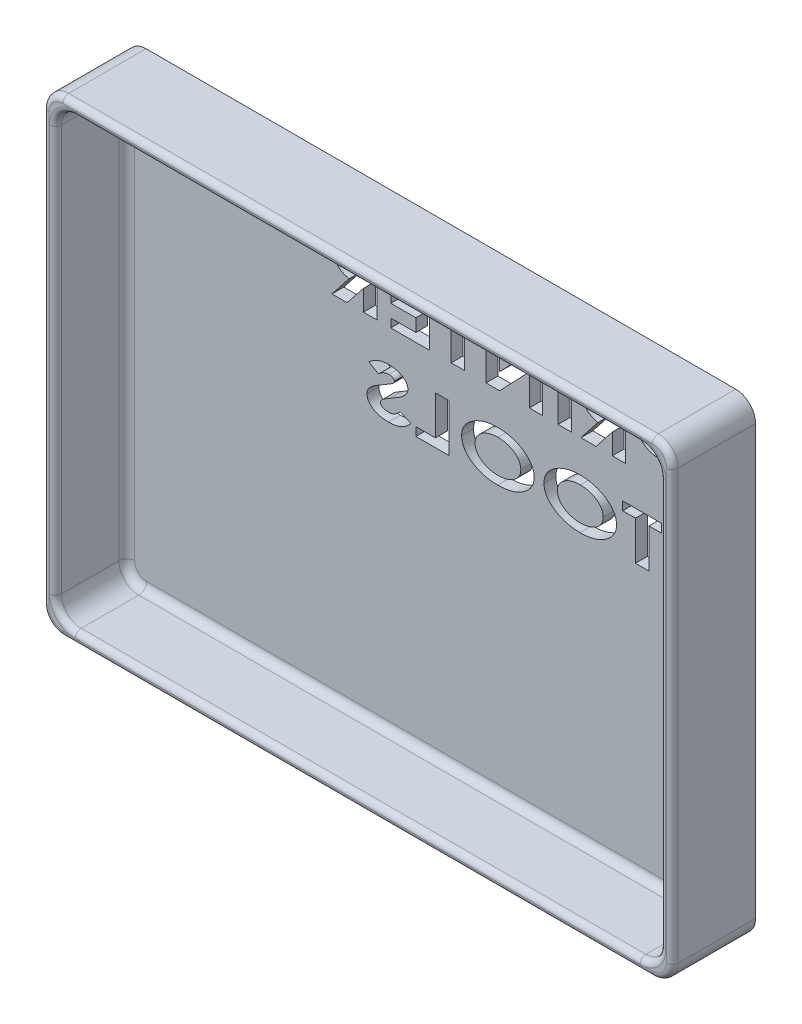
from build123d import *

# Parameters (mm, degrees)
SKETCH1_W              = 158.683863027
SKETCH1_H              = 118.102023858
BOSS_EXTRUDE1_DEPTH    = 3
BOSS_EXTRUDE2_DEPTH    = 21
CUT_EXTRUDE1_START     = -3
CUT_EXTRUDE1_OUTLINE_W = 3.384615385
CUT_EXTRUDE1_OUTLINE_H = 12
CUT_EXTRUDE1_DEPTH     = 3
FILLET1_R              = 5
FILLET2_R              = 2
FILLET3_R              = 1.5


# Read off the part's stored shape, not the designer's step: Cut-Extrude1
with BuildPart() as part:
    # Sketch1 → Boss-Extrude1 (new body)
    with BuildSketch(Plane.XY):
        with Locations((1.187532467, -8.698701299)):
            Rectangle(SKETCH1_W, SKETCH1_H)
    extrude(amount=BOSS_EXTRUDE1_DEPTH)

    # Sketch1<3> → Boss-Extrude2 (add)
    with BuildSketch(Plane.XY):
        Polygon((-75.012467532, 47.501298701), (77.387532468, 47.501298701), (80.529463981, 50.35231063), (-78.154399046, 50.35231063), align=None)
        Polygon((77.387532468, 47.501298701), (77.387532468, -64.898701299), (80.529463981, -67.749713228), (80.529463981, 50.35231063), align=None)
        Polygon((77.387532468, -64.898701299), (80.529463981, -67.749713228), (-78.154399046, -67.749713228), (-78.154399046, 50.35231063), (-75.012467532, 47.501298701), (-75.012467532, -64.898701299), align=None)
    extrude(amount=BOSS_EXTRUDE2_DEPTH)

    # Cut-Extrude1 outline → Cut-Extrude1 (cut)
    # profile 1 of 12: a face of its own
    with BuildSketch(Plane(origin=(0, 0, 0), x_dir=(-1, 0, 0), z_dir=(0, 0, -1)).offset(CUT_EXTRUDE1_START)):
        with BuildLine():
            add(Edge.make_bspline(
                [(-61.338670517, 35.229174761), (-61.103084496, 35.228486284), (-60.64947422, 35.227160653), (-59.994655416, 35.210567101), (-59.391222931, 35.181379158), (-58.837960645, 35.144653532), (-58.335434607, 35.09378821), (-57.883619534, 35.035607474), (-57.483049594, 34.964416288), (-57.128326221, 34.879596374), (-56.808221375, 34.780577314), (-56.508096786, 34.674459724), (-56.228373705, 34.547079836), (-55.961258374, 34.415306874), (-55.716372132, 34.260789572), (-55.484356361, 34.099358589), (-55.272057453, 33.919854103), (-55.077365877, 33.727951904), (-54.902360005, 33.524882351), (-54.749144147, 33.311141098), (-54.618321929, 33.088275523), (-54.515304306, 32.852735764), (-54.433387467, 32.608988354), (-54.371707954, 32.355185588), (-54.339117298, 32.090609267), (-54.334028587, 31.911144111), (-54.331458979, 31.820520915)],
                knots=[0, 0, 0, 0, 0.081113678, 0.156180735, 0.22550834, 0.289116505, 0.347067955, 0.39939195, 0.445931657, 0.487084678, 0.524873618, 0.561267118, 0.596590797, 0.630645116, 0.663720921, 0.696177651, 0.727899058, 0.759308193, 0.790220241, 0.820078933, 0.849748386, 0.879021393, 0.908422828, 0.938201113, 0.968793872, 1, 1, 1, 1], degree=3))
            Line((-61.338670517, 35.229174761), (-64.946843594, 35.229174761))
            Line((-64.946843594, 35.229174761), (-64.946843594, 23.229174761))
            Line((-64.946843594, 23.229174761), (-61.562228209, 23.229174761))
            Line((-61.562228209, 23.229174761), (-61.562228209, 28.459943992))
            add(Edge.make_bspline(
                [(-57.970882056, 28.6426363), (-58.061299443, 28.627306207), (-58.258263836, 28.593911277), (-58.581085365, 28.560647266), (-58.953733939, 28.529455427), (-59.377677813, 28.502857971), (-59.852197033, 28.484999704), (-60.377866321, 28.47069173), (-60.95321476, 28.460520361), (-61.353890153, 28.460141163), (-61.562228209, 28.459943992)],
                knots=[0, 0, 0, 0, 0.076414094, 0.166459751, 0.270333959, 0.388098118, 0.520432678, 0.666070712, 0.826367729, 1, 1, 1, 1], degree=3))
            add(Edge.make_bspline(
                [(-54.331458979, 31.820520915), (-54.333972207, 31.720182534), (-54.338925379, 31.52243153), (-54.38582871, 31.232816525), (-54.462798333, 30.955981783), (-54.572505439, 30.692946031), (-54.709270772, 30.441016417), (-54.880156046, 30.204167383), (-55.080033189, 29.979355114), (-55.312835333, 29.772354632), (-55.566755512, 29.574061602), (-55.846249308, 29.395238915), (-56.146563014, 29.230471813), (-56.469075882, 29.082224022), (-56.81352202, 28.94775607), (-57.179244199, 28.827540012), (-57.56682389, 28.723593828), (-57.834329238, 28.669996169), (-57.970882056, 28.6426363)],
                knots=[0, 0, 0, 0, 0.057106212, 0.112547268, 0.166578841, 0.220390294, 0.27450851, 0.329464812, 0.386346329, 0.445466309, 0.506620577, 0.569654476, 0.634188479, 0.701563956, 0.771643545, 0.844661138, 0.920704542, 1, 1, 1, 1], degree=3))
        make_face()
        with BuildLine():
            add(Edge.make_bspline(
                [(-60.502132056, 30.613790146), (-60.401970667, 30.614444638), (-60.209649816, 30.615701335), (-59.933153066, 30.619842513), (-59.679854898, 30.629109753), (-59.45072655, 30.644018865), (-59.244548194, 30.659741272), (-59.063483474, 30.681670777), (-58.90518777, 30.704747877), (-58.729827182, 30.742120432), (-58.537399643, 30.802224006), (-58.330649897, 30.893888871), (-58.148772663, 31.003496777), (-57.994831726, 31.134689447), (-57.87101537, 31.283964705), (-57.779984271, 31.449937309), (-57.724607429, 31.631954353), (-57.718955852, 31.758436922), (-57.716074363, 31.822924761)],
                knots=[0, 0, 0, 0, 0.088908409, 0.170713896, 0.24544874, 0.313861441, 0.374521884, 0.428954165, 0.47572897, 0.516462857, 0.58799864, 0.654220813, 0.716798205, 0.775814359, 0.832913607, 0.887974223, 0.942883036, 1, 1, 1, 1], degree=3))
            Line((-60.502132056, 30.613790146), (-61.562228209, 30.613790146))
            Line((-61.562228209, 30.613790146), (-61.562228209, 33.075328608))
            Line((-61.562228209, 33.075328608), (-60.622324363, 33.075328608))
            add(Edge.make_bspline(
                [(-58.502132056, 32.837347838), (-58.554722277, 32.856704993), (-58.66790156, 32.898363475), (-58.858112074, 32.945026453), (-59.077378685, 32.984615405), (-59.327631043, 33.018401549), (-59.607558177, 33.043696015), (-59.918540471, 33.063574813), (-60.260108348, 33.071423187), (-60.498125347, 33.073989491), (-60.622324363, 33.075328608)],
                knots=[0, 0, 0, 0, 0.078376775, 0.168674459, 0.273588489, 0.390153308, 0.52193405, 0.666870742, 0.82617071, 1, 1, 1, 1], degree=3))
            add(Edge.make_bspline(
                [(-57.716074363, 31.822924761), (-57.718305564, 31.879194098), (-57.722657642, 31.988950489), (-57.75903025, 32.148108707), (-57.823559844, 32.294397733), (-57.909931075, 32.430165526), (-58.023199236, 32.551860064), (-58.160405067, 32.659842848), (-58.319456331, 32.760630236), (-58.439542306, 32.811062269), (-58.502132056, 32.837347838)],
                knots=[0, 0, 0, 0, 0.122923274, 0.23976851, 0.354306578, 0.470915258, 0.5899199, 0.71575388, 0.851848698, 1, 1, 1, 1], degree=3))
        make_face(mode=Mode.SUBTRACT)
    # profile 2 of 12: a face of its own
    with BuildSketch(Plane(origin=(0, 0, 0), x_dir=(-1, 0, 0), z_dir=(0, 0, -1)).offset(CUT_EXTRUDE1_START)):
        with BuildLine():
            add(Edge.make_bspline(
                [(8.928156406, 14.998405531), (9.143935073, 14.993269276), (9.571262309, 14.983097458), (10.203240494, 14.903545004), (10.819487901, 14.776764515), (11.321421027, 14.625789296), (11.719905179, 14.475220182), (12.024975031, 14.340670511), (12.334957082, 14.182685631), (12.653883651, 14.007845487), (12.976494419, 13.807479137), (13.306720783, 13.588875709), (13.641423397, 13.347667335), (13.862990008, 13.175396135), (13.976233329, 13.087347838)],
                knots=[0, 0, 0, 0, 0.117383059, 0.232464956, 0.346021993, 0.459404796, 0.517222591, 0.577739236, 0.640720293, 0.706487541, 0.775582806, 0.847291856, 0.921950437, 1, 1, 1, 1], degree=3))
            add(Edge.make_bspline(
                [(4.130079483, 11.9551363), (4.134108574, 12.058059425), (4.14209179, 12.261990674), (4.21030802, 12.561624882), (4.318908258, 12.849891287), (4.472468336, 13.126455666), (4.6705494, 13.389153757), (4.907514773, 13.643926103), (5.191387486, 13.883489423), (5.513842289, 14.109147513), (5.867384861, 14.316820253), (6.244993093, 14.499860511), (6.643498802, 14.653120834), (7.060816058, 14.781645496), (7.498967826, 14.879396639), (7.957562991, 14.948913702), (8.436223183, 14.989804995), (8.762212176, 14.995504305), (8.928156406, 14.998405531)],
                knots=[0, 0, 0, 0, 0.049357486, 0.097796619, 0.146734136, 0.196835447, 0.2490722, 0.304319524, 0.363522771, 0.427020094, 0.493056637, 0.560151219, 0.628226583, 0.697824819, 0.769586562, 0.843517546, 0.920342831, 1, 1, 1, 1], degree=3))
            add(Edge.make_bspline(
                [(8.666137175, 7.743597838), (8.437357084, 7.872681148), (7.999601495, 8.119673532), (7.378187996, 8.48539006), (6.819971734, 8.828575498), (6.325061174, 9.149493108), (5.893772173, 9.44769365), (5.524100847, 9.720703134), (5.218240991, 9.971585756), (4.969328015, 10.204222167), (4.771940558, 10.430383163), (4.597538339, 10.645204496), (4.45733254, 10.865642743), (4.336485464, 11.082511874), (4.245224797, 11.301277055), (4.180301909, 11.519688645), (4.135879567, 11.736989833), (4.132002513, 11.882809358), (4.130079483, 11.9551363)],
                knots=[0, 0, 0, 0, 0.122390303, 0.234185759, 0.335932589, 0.427680274, 0.508976885, 0.580210654, 0.641731503, 0.69322682, 0.738710084, 0.781507703, 0.821997537, 0.860255403, 0.897072557, 0.932152684, 0.966347519, 1, 1, 1, 1], degree=3))
            add(Edge.make_bspline(
                [(11.053156406, 5.6738863), (11.048152971, 5.742856905), (11.037783284, 5.885799437), (10.944043941, 6.093598051), (10.80419999, 6.301101832), (10.641618463, 6.468196998), (10.475539673, 6.607260051), (10.315782409, 6.730875805), (10.121708452, 6.866017492), (9.89454024, 7.015376707), (9.634678609, 7.178551446), (9.342259807, 7.35579432), (9.016149492, 7.546613633), (8.786530651, 7.675841328), (8.666137175, 7.743597838)],
                knots=[0, 0, 0, 0, 0.062969602, 0.13050537, 0.205695662, 0.291958675, 0.343039607, 0.404319287, 0.477087212, 0.55981761, 0.65358231, 0.758414432, 0.873332144, 1, 1, 1, 1], degree=3))
            add(Edge.make_bspline(
                [(9.038733329, 4.536867069), (9.175245961, 4.540680021), (9.439503872, 4.548061043), (9.817408385, 4.614080602), (10.1636765, 4.718284258), (10.420969785, 4.847490441), (10.606366755, 4.962467115), (10.724598576, 5.053797891), (10.824605556, 5.149358629), (10.90975528, 5.245707082), (10.972535677, 5.349024204), (11.020269838, 5.453372049), (11.046891018, 5.56280504), (11.051070223, 5.636899627), (11.053156406, 5.6738863)],
                knots=[0, 0, 0, 0, 0.162326861, 0.314228481, 0.455070169, 0.591104312, 0.655387981, 0.714514441, 0.768471015, 0.819873192, 0.866974029, 0.911800014, 0.955972167, 1, 1, 1, 1], degree=3))
            add(Edge.make_bspline(
                [(6.146906406, 6.075328608), (6.251247605, 5.953065477), (6.454265689, 5.71517645), (6.788214963, 5.401654918), (7.132840041, 5.13464747), (7.490538191, 4.916221753), (7.860142174, 4.746622068), (8.241718373, 4.625047338), (8.635975012, 4.550447086), (8.903796478, 4.541416807), (9.038733329, 4.536867069)],
                knots=[0, 0, 0, 0, 0.142103254, 0.276492224, 0.404377118, 0.527160615, 0.646425526, 0.763221357, 0.880703496, 1, 1, 1, 1], degree=3))
            Line((6.146906406, 6.075328608), (3.360848714, 4.938309377))
            add(Edge.make_bspline(
                [(9.031521791, 2.383020915), (8.876826887, 2.384791195), (8.572769905, 2.388270727), (8.12439393, 2.417978497), (7.691929895, 2.465254669), (7.273994809, 2.533036223), (6.870966835, 2.618682452), (6.482597303, 2.724870795), (6.109896453, 2.849319215), (5.751714832, 2.994391188), (5.407665994, 3.159920072), (5.077137057, 3.348467086), (4.759301953, 3.558180493), (4.452470525, 3.789192406), (4.160556708, 4.045098472), (3.877300427, 4.318901547), (3.610258751, 4.617982348), (3.444584312, 4.830764485), (3.360848714, 4.938309377)],
                knots=[0, 0, 0, 0, 0.0716858, 0.140900364, 0.208154577, 0.273234001, 0.33703695, 0.39901669, 0.459728605, 0.519032979, 0.577994543, 0.63653714, 0.695244395, 0.754363619, 0.814379911, 0.875041835, 0.936843325, 1, 1, 1, 1], degree=3))
            add(Edge.make_bspline(
                [(14.437771791, 5.7988863), (14.433118405, 5.677553623), (14.423948153, 5.438447852), (14.351916443, 5.087820234), (14.233841558, 4.754512846), (14.067638614, 4.437403462), (13.853016573, 4.138561223), (13.595013927, 3.852683422), (13.285198826, 3.589154983), (12.93629344, 3.339761713), (12.548088573, 3.116693844), (12.130190323, 2.91745346), (11.682351739, 2.752912016), (11.206358564, 2.618493342), (10.702675126, 2.513228293), (10.171257735, 2.436832795), (9.610886773, 2.390215963), (9.2279284, 2.38546006), (9.031521791, 2.383020915)],
                knots=[0, 0, 0, 0, 0.051356754, 0.101206836, 0.150904202, 0.200693022, 0.252294751, 0.306352288, 0.363371091, 0.424204089, 0.487766467, 0.552738298, 0.620064069, 0.689568172, 0.762050763, 0.837833145, 0.916830015, 1, 1, 1, 1], degree=3))
            add(Edge.make_bspline(
                [(12.574791021, 8.551290146), (12.656925326, 8.493351146), (12.816593742, 8.380718203), (13.042620586, 8.207408298), (13.250611128, 8.036202994), (13.439417735, 7.867265277), (13.60930446, 7.698746975), (13.764307016, 7.535523738), (13.894974969, 7.368163666), (14.050001034, 7.155955675), (14.202748703, 6.879878319), (14.341833441, 6.534546724), (14.422462202, 6.171173493), (14.432648783, 5.923463784), (14.437771791, 5.7988863)],
                knots=[0, 0, 0, 0, 0.086899156, 0.168931249, 0.246193543, 0.319780837, 0.387876716, 0.453077543, 0.514209315, 0.571309905, 0.680188041, 0.785939836, 0.892345452, 1, 1, 1, 1], degree=3))
            add(Edge.make_bspline(
                [(10.259887175, 9.935905531), (10.411356491, 9.848613006), (10.698452351, 9.683158225), (11.105869295, 9.447400574), (11.465339206, 9.236137192), (11.779129647, 9.051044839), (12.044801237, 8.890191858), (12.264610129, 8.756430058), (12.435487941, 8.645626968), (12.533203796, 8.579453247), (12.574791021, 8.551290146)],
                knots=[0, 0, 0, 0, 0.194399367, 0.36846574, 0.523419409, 0.658044401, 0.773566774, 0.868771443, 0.944149989, 1, 1, 1, 1], degree=3))
            add(Edge.make_bspline(
                [(7.812771791, 11.483982454), (7.854807488, 11.448962714), (7.952904692, 11.367238399), (8.134064701, 11.242341723), (8.361052437, 11.084455699), (8.643678209, 10.906515578), (8.974391043, 10.698939374), (9.358485996, 10.469619786), (9.789994347, 10.208267318), (10.09770411, 10.029910944), (10.259887175, 9.935905531)],
                knots=[0, 0, 0, 0, 0.05661293, 0.132115571, 0.227598081, 0.342877559, 0.477757266, 0.631823175, 0.805946859, 1, 1, 1, 1], degree=3))
            add(Edge.make_bspline(
                [(7.514694867, 12.058501685), (7.518713819, 12.008340828), (7.52692389, 11.905870285), (7.586198897, 11.756014656), (7.682265875, 11.612147056), (7.767781419, 11.528165685), (7.812771791, 11.483982454)],
                knots=[0, 0, 0, 0, 0.22572439, 0.461118544, 0.716490412, 1, 1, 1, 1], degree=3))
            add(Edge.make_bspline(
                [(8.971425637, 12.844559377), (8.869481623, 12.842225455), (8.674078922, 12.837751875), (8.395076389, 12.79196536), (8.144957027, 12.715331399), (7.927538928, 12.611531988), (7.751199502, 12.488475132), (7.616306951, 12.35786572), (7.532066658, 12.211952137), (7.520329843, 12.108277185), (7.514694867, 12.058501685)],
                knots=[0, 0, 0, 0, 0.170010369, 0.325869899, 0.470092533, 0.605252866, 0.726191263, 0.827366749, 0.917116852, 1, 1, 1, 1], degree=3))
            add(Edge.make_bspline(
                [(11.562771791, 11.613790146), (11.457577053, 11.711518163), (11.253236029, 11.901355063), (10.932004565, 12.152622428), (10.609675289, 12.365062919), (10.286067201, 12.540232125), (9.960006964, 12.676306224), (9.631972912, 12.772545781), (9.302211883, 12.833451812), (9.08145573, 12.840864645), (8.971425637, 12.844559377)],
                knots=[0, 0, 0, 0, 0.146393428, 0.284369575, 0.415381266, 0.539696733, 0.659137966, 0.77498857, 0.887848976, 1, 1, 1, 1], degree=3))
            Line((11.562771791, 11.613790146), (13.976233329, 13.087347838))
        make_face()
    # profile 3 of 12: a face of its own
    with BuildSketch(Plane(origin=(0, 0, 0), x_dir=(-1, 0, 0), z_dir=(0, 0, -1)).offset(CUT_EXTRUDE1_START)):
        with BuildLine():
            add(Edge.make_bspline(
                [(-27.716074363, 8.695520915), (-27.712485328, 8.837562102), (-27.705338317, 9.120415248), (-27.644504854, 9.539284326), (-27.552841223, 9.950663532), (-27.414889688, 10.350802287), (-27.24560558, 10.745013719), (-27.030720529, 11.127237294), (-26.783539979, 11.503869157), (-26.496095229, 11.867845505), (-26.17873447, 12.220352651), (-25.827343654, 12.552489933), (-25.449835353, 12.868027825), (-25.042527366, 13.164176258), (-24.605949683, 13.43933244), (-24.144125868, 13.701590506), (-23.649873473, 13.936870285), (-23.13235941, 14.158092291), (-22.595267799, 14.356975974), (-22.043158697, 14.526171835), (-21.483308911, 14.674918349), (-20.911385247, 14.790829771), (-20.330354122, 14.886609884), (-19.737932244, 14.948864089), (-19.135817501, 14.993065413), (-18.730580795, 14.996615027), (-18.526170517, 14.998405531)],
                knots=[0, 0, 0, 0, 0.034662008, 0.069024051, 0.103145232, 0.137418057, 0.172199657, 0.207751222, 0.244321632, 0.282086492, 0.320867807, 0.360027706, 0.400029309, 0.440920366, 0.48287212, 0.525967777, 0.570503772, 0.616433292, 0.663349629, 0.710252913, 0.757371118, 0.804716206, 0.852669709, 0.901083895, 0.950104548, 1, 1, 1, 1], degree=3))
            add(Edge.make_bspline(
                [(-18.502132056, 2.383020915), (-18.665619808, 2.384363784), (-18.989534529, 2.387024379), (-19.469710959, 2.409511954), (-19.939726066, 2.444226703), (-20.398759547, 2.49875994), (-20.847982632, 2.562421281), (-21.286823178, 2.641558707), (-21.714148106, 2.737602061), (-22.131205726, 2.849826159), (-22.53978536, 2.97009809), (-22.936288167, 3.110475661), (-23.321976968, 3.264563711), (-23.697268496, 3.433045655), (-24.062576869, 3.615161864), (-24.416733113, 3.813119782), (-24.76083306, 4.024778954), (-25.092949553, 4.249248189), (-25.409732152, 4.484301049), (-25.707388132, 4.726457844), (-25.984352081, 4.974114958), (-26.240627577, 5.227358934), (-26.475811862, 5.487156967), (-26.692870861, 5.751006368), (-26.888052593, 6.020678207), (-27.062281572, 6.296094847), (-27.215424844, 6.577543927), (-27.352056781, 6.862807721), (-27.460782898, 7.156059512), (-27.556769966, 7.451931966), (-27.628483758, 7.755071513), (-27.678079845, 8.063646715), (-27.711373933, 8.377483967), (-27.71449803, 8.588864205), (-27.716074363, 8.695520915)],
                knots=[0, 0, 0, 0, 0.039752396, 0.078760556, 0.116867305, 0.154328493, 0.191142079, 0.227181829, 0.26272891, 0.297608094, 0.332189955, 0.366267541, 0.399844021, 0.433159431, 0.466271383, 0.499068258, 0.531784005, 0.564478857, 0.596511527, 0.627672498, 0.657752971, 0.686823874, 0.715238995, 0.742931476, 0.769862925, 0.796134319, 0.822118745, 0.847744199, 0.872966478, 0.898108101, 0.923344675, 0.948618078, 0.974074081, 1, 1, 1, 1], degree=3))
            add(Edge.make_bspline(
                [(-9.408382056, 8.654655531), (-9.410064211, 8.546412123), (-9.413410769, 8.331067711), (-9.445356312, 8.011298093), (-9.499137436, 7.697652801), (-9.570130215, 7.389549942), (-9.664933752, 7.088840049), (-9.778101485, 6.793814903), (-9.912640097, 6.505220963), (-10.069693271, 6.224043613), (-10.246089335, 5.948565445), (-10.442957553, 5.679072767), (-10.663324345, 5.417559725), (-10.900798669, 5.159252998), (-11.161126064, 4.910007011), (-11.441292885, 4.666413666), (-11.741585199, 4.428270412), (-12.170950057, 4.12187594), (-12.73826259, 3.767133843), (-13.456524935, 3.395379209), (-14.212224326, 3.082999416), (-15.002077291, 2.825357076), (-15.827535112, 2.625683507), (-16.688089493, 2.485003473), (-17.583730826, 2.39957055), (-18.192647555, 2.388597841), (-18.502132056, 2.383020915)],
                knots=[0, 0, 0, 0, 0.026603698, 0.052926619, 0.07889785, 0.104794275, 0.130587111, 0.156340051, 0.182424577, 0.208788739, 0.235453621, 0.262795981, 0.290765468, 0.319479696, 0.349013258, 0.379310111, 0.410719298, 0.443189014, 0.508938954, 0.575013249, 0.641773676, 0.709733363, 0.779055341, 0.850330347, 0.923929766, 1, 1, 1, 1], degree=3))
            add(Edge.make_bspline(
                [(-18.526170517, 14.998405531), (-18.219868721, 14.993070038), (-17.617228461, 14.982572605), (-16.729682915, 14.893549849), (-15.874739507, 14.750746051), (-15.052459271, 14.548812849), (-14.263201051, 14.288411716), (-13.50641224, 13.970919723), (-12.782138318, 13.594410855), (-12.209371714, 13.23364218), (-11.772959254, 12.925201206), (-11.470162781, 12.682797529), (-11.184199879, 12.438029287), (-10.921919379, 12.184289906), (-10.678468544, 11.925303009), (-10.458271377, 11.659136861), (-10.258111875, 11.387251669), (-10.078523471, 11.108953399), (-9.921243221, 10.824246842), (-9.781850966, 10.533670818), (-9.667236511, 10.235958947), (-9.573354639, 9.931371887), (-9.498321755, 9.621641504), (-9.445586119, 9.30515874), (-9.413272497, 8.982261662), (-9.410021891, 8.764506585), (-9.408382056, 8.654655531)],
                knots=[0, 0, 0, 0, 0.074934678, 0.147431895, 0.218022953, 0.286880571, 0.354400944, 0.421184838, 0.487482285, 0.55390515, 0.58665779, 0.618197223, 0.648778704, 0.678730199, 0.7074452, 0.735712239, 0.763202254, 0.790014779, 0.816695074, 0.842742532, 0.868812857, 0.894673689, 0.920686441, 0.946730948, 0.973127325, 1, 1, 1, 1], degree=3))
        make_face()
        with BuildLine():
            add(Edge.make_bspline(
                [(-18.57424744, 12.844559377), (-18.773098979, 12.840818323), (-19.164370907, 12.833457205), (-19.738597057, 12.776930465), (-20.289323047, 12.687065646), (-20.81474164, 12.556589355), (-21.316393615, 12.390671765), (-21.794824611, 12.188908411), (-22.247725244, 11.947102215), (-22.67323382, 11.673315724), (-23.060524934, 11.371034444), (-23.40114754, 11.045761896), (-23.685811424, 10.697420018), (-23.922741135, 10.331563268), (-24.10755543, 9.944066541), (-24.236885865, 9.535535745), (-24.316479709, 9.107261848), (-24.326407363, 8.815258539), (-24.331458979, 8.666674761)],
                knots=[0, 0, 0, 0, 0.075469792, 0.148498781, 0.218802791, 0.287112615, 0.353767091, 0.41918527, 0.483952533, 0.548408381, 0.611017881, 0.670172015, 0.726797237, 0.781384459, 0.835260344, 0.889222874, 0.943631859, 1, 1, 1, 1], degree=3))
            add(Edge.make_bspline(
                [(-12.79299744, 8.683501685), (-12.797943013, 8.826501536), (-12.807718119, 9.10914597), (-12.889878696, 9.523997056), (-13.023383259, 9.920936356), (-13.207070101, 10.302789655), (-13.448704211, 10.663886434), (-13.739291916, 11.010945671), (-14.086060591, 11.336799381), (-14.478157958, 11.644334579), (-14.906655353, 11.925331713), (-15.363825337, 12.171294269), (-15.842264944, 12.381629028), (-16.345762902, 12.549359254), (-16.870605146, 12.681103954), (-17.418190015, 12.778316408), (-17.988985745, 12.83307056), (-18.377018918, 12.840687737), (-18.57424744, 12.844559377)],
                knots=[0, 0, 0, 0, 0.054396335, 0.107516344, 0.160276976, 0.213480112, 0.268298962, 0.325238915, 0.385432165, 0.449075244, 0.514723768, 0.580231133, 0.646476403, 0.713416018, 0.781992977, 0.852298228, 0.924926516, 1, 1, 1, 1], degree=3))
            add(Edge.make_bspline(
                [(-18.514151286, 4.536867069), (-18.319315601, 4.540653161), (-17.936855825, 4.548085208), (-17.374310147, 4.603844855), (-16.83393163, 4.698337882), (-16.314678786, 4.826079099), (-15.81810073, 4.996138959), (-15.343987193, 5.203190566), (-14.890917809, 5.446091111), (-14.465278595, 5.7232557), (-14.075563157, 6.027693268), (-13.732985154, 6.353748964), (-13.442850809, 6.698422509), (-13.205068396, 7.060208589), (-13.020480149, 7.441806601), (-12.887171542, 7.839677336), (-12.808274266, 8.256513862), (-12.798141048, 8.539737669), (-12.79299744, 8.683501685)],
                knots=[0, 0, 0, 0, 0.074701508, 0.146638033, 0.216496739, 0.284904612, 0.35146104, 0.417504886, 0.483075344, 0.548353615, 0.612030912, 0.672442297, 0.729365999, 0.784417281, 0.838009675, 0.89144772, 0.944899012, 1, 1, 1, 1], degree=3))
            add(Edge.make_bspline(
                [(-22.240112825, 5.459943992), (-22.103306764, 5.385789886), (-21.829542251, 5.237399073), (-21.399697002, 5.051152969), (-20.955899924, 4.891335344), (-20.49625956, 4.762074451), (-20.021707028, 4.660944185), (-19.532726388, 4.589429783), (-19.028606428, 4.544819544), (-18.68732186, 4.539543949), (-18.514151286, 4.536867069)],
                knots=[0, 0, 0, 0, 0.120206487, 0.240546872, 0.361592551, 0.484500786, 0.609229937, 0.736298135, 0.866195523, 1, 1, 1, 1], degree=3))
            add(Edge.make_bspline(
                [(-24.331458979, 8.666674761), (-24.330552407, 8.583257045), (-24.328760577, 8.41838273), (-24.299974774, 8.174444432), (-24.259552446, 7.936852646), (-24.205648246, 7.70454974), (-24.12932304, 7.481367846), (-24.040985294, 7.262629956), (-23.932725299, 7.052650246), (-23.808547244, 6.849529913), (-23.671511869, 6.650618013), (-23.515801173, 6.459886155), (-23.343208083, 6.275960603), (-23.155962793, 6.097891927), (-22.950968449, 5.927217164), (-22.729367138, 5.763605061), (-22.490942443, 5.607776716), (-22.324647453, 5.509766594), (-22.240112825, 5.459943992)],
                knots=[0, 0, 0, 0, 0.062013384, 0.122568858, 0.182439934, 0.241278543, 0.299708178, 0.357707583, 0.416618602, 0.475190945, 0.534713887, 0.596151728, 0.658142193, 0.722226309, 0.788238319, 0.856426346, 0.927015568, 1, 1, 1, 1], degree=3))
        make_face(mode=Mode.SUBTRACT)
    # profile 4 of 12: a face of its own
    with BuildSketch(Plane(origin=(0, 0, 0), x_dir=(-1, 0, 0), z_dir=(0, 0, -1)).offset(CUT_EXTRUDE1_START)):
        with BuildLine():
            add(Edge.make_bspline(
                [(-47.237708979, 35.229174761), (-47.002919922, 35.228577836), (-46.550903648, 35.227428633), (-45.899381877, 35.209649114), (-45.300594367, 35.184661438), (-44.754622145, 35.146964549), (-44.260854555, 35.096481619), (-43.819708686, 35.037561176), (-43.430109066, 34.969441265), (-43.087541149, 34.886524882), (-42.778676166, 34.791106713), (-42.491334952, 34.682563034), (-42.219009903, 34.559996935), (-41.961225748, 34.422707553), (-41.717969015, 34.271856605), (-41.491193323, 34.104728519), (-41.278906206, 33.924984202), (-41.084693362, 33.7294465), (-40.907044482, 33.525639291), (-40.753590559, 33.308786884), (-40.624776925, 33.082725479), (-40.514295516, 32.849185266), (-40.432766242, 32.604394182), (-40.376157529, 32.351365297), (-40.337789878, 32.089308179), (-40.333594922, 31.91120539), (-40.331458979, 31.820520915)],
                knots=[0, 0, 0, 0, 0.081737334, 0.157360847, 0.226889761, 0.290370901, 0.347857075, 0.39965742, 0.445292836, 0.485482517, 0.522276763, 0.557767294, 0.592351648, 0.626171511, 0.659378359, 0.691906877, 0.724161516, 0.756116805, 0.787766224, 0.818184434, 0.848425606, 0.878254821, 0.907983427, 0.938029688, 0.968446619, 1, 1, 1, 1], degree=3))
            Line((-47.237708979, 35.229174761), (-50.79299744, 35.229174761))
            Line((-50.79299744, 35.229174761), (-50.79299744, 23.229174761))
            Line((-50.79299744, 23.229174761), (-47.408382056, 23.229174761))
            Line((-47.408382056, 23.229174761), (-47.408382056, 28.414273714))
            Line((-47.408382056, 28.414273714), (-43.314632056, 23.229174761))
            Line((-43.314632056, 23.229174761), (-39.485305133, 23.229174761))
            Line((-39.485305133, 23.229174761), (-43.807420517, 28.7051363))
            add(Edge.make_bspline(
                [(-40.331458979, 31.820520915), (-40.334656166, 31.725878447), (-40.340941615, 31.539817873), (-40.377916123, 31.265748911), (-40.450061938, 31.005740265), (-40.543094667, 30.754873202), (-40.666660062, 30.517970972), (-40.814701742, 30.290260917), (-40.992998932, 30.078133004), (-41.197650934, 29.876492462), (-41.428002898, 29.68659833), (-41.688045982, 29.511977407), (-41.97158254, 29.344359136), (-42.28663556, 29.194604267), (-42.627344191, 29.052627826), (-42.995980918, 28.923639453), (-43.391254435, 28.804900284), (-43.666034964, 28.739029466), (-43.807420517, 28.7051363)],
                knots=[0, 0, 0, 0, 0.055883317, 0.109862752, 0.162753695, 0.214845556, 0.267518225, 0.320122897, 0.374867744, 0.43072103, 0.48952438, 0.550788975, 0.615441578, 0.683768253, 0.756497506, 0.833237835, 0.914194208, 1, 1, 1, 1], degree=3))
        make_face()
        with BuildLine():
            add(Edge.make_bspline(
                [(-46.403574363, 30.613790146), (-46.280975506, 30.614955726), (-46.045332032, 30.617196053), (-45.706062774, 30.627395776), (-45.396681192, 30.652186502), (-45.11768608, 30.683159431), (-44.868181913, 30.71932017), (-44.649511566, 30.770915597), (-44.458700222, 30.826204188), (-44.296721211, 30.894391914), (-44.158813136, 30.972803982), (-44.039648141, 31.061351122), (-43.939948201, 31.164168815), (-43.856712656, 31.277601608), (-43.794293921, 31.404938804), (-43.74825499, 31.542223325), (-43.721617136, 31.692103438), (-43.717970308, 31.795573919), (-43.716074363, 31.849367069)],
                knots=[0, 0, 0, 0, 0.110716484, 0.212804733, 0.306425986, 0.390886168, 0.466308267, 0.533884161, 0.593626249, 0.645502109, 0.692171316, 0.736599077, 0.779068697, 0.821042303, 0.863109358, 0.906584134, 0.951434132, 1, 1, 1, 1], degree=3))
            Line((-46.403574363, 30.613790146), (-47.408382056, 30.613790146))
            Line((-47.408382056, 30.613790146), (-47.408382056, 33.075328608))
            Line((-47.408382056, 33.075328608), (-46.528574363, 33.075328608))
            add(Edge.make_bspline(
                [(-43.716074363, 31.849367069), (-43.718770626, 31.913122426), (-43.724101358, 32.039172019), (-43.78308325, 32.219499959), (-43.873711422, 32.386986813), (-44.000404349, 32.538609786), (-44.157404516, 32.671197125), (-44.337201529, 32.789217993), (-44.543626905, 32.881706423), (-44.734601465, 32.942274572), (-44.908570721, 32.979165408), (-45.065594676, 33.006137286), (-45.247925957, 33.026055337), (-45.455366702, 33.046155686), (-45.687897902, 33.059739626), (-45.945965471, 33.069396176), (-46.228883662, 33.073381873), (-46.426010083, 33.074662369), (-46.528574363, 33.075328608)],
                knots=[0, 0, 0, 0, 0.05591278, 0.110544173, 0.165120952, 0.222710852, 0.283196756, 0.345380313, 0.41131144, 0.481546025, 0.521232899, 0.5677091, 0.621663066, 0.682554357, 0.751069528, 0.826556637, 0.909757943, 1, 1, 1, 1], degree=3))
        make_face(mode=Mode.SUBTRACT)
    # profile 5 of 12: a face of its own
    with BuildSketch(Plane(origin=(0, 0, 0), x_dir=(-1, 0, 0), z_dir=(0, 0, -1)).offset(CUT_EXTRUDE1_START)):
        with BuildLine():
            add(Edge.make_bspline(
                [(15.531521791, 35.229174761), (15.766310848, 35.228577836), (16.218327121, 35.227428633), (16.869848892, 35.209649114), (17.468636403, 35.184661438), (18.014608624, 35.146964549), (18.508376215, 35.096481619), (18.949522084, 35.037561176), (19.339121703, 34.969441265), (19.68168962, 34.886524882), (19.990554603, 34.791106713), (20.277895817, 34.682563034), (20.550220867, 34.559996935), (20.808005021, 34.422707553), (21.051261754, 34.271856605), (21.278037446, 34.104728519), (21.490324564, 33.924984202), (21.684537407, 33.7294465), (21.862186287, 33.525639291), (22.015640211, 33.308786884), (22.144453844, 33.082725479), (22.254935253, 32.849185266), (22.336464527, 32.604394182), (22.39307324, 32.351365297), (22.431440891, 32.089308179), (22.435635847, 31.91120539), (22.437771791, 31.820520915)],
                knots=[0, 0, 0, 0, 0.081737334, 0.157360847, 0.226889761, 0.290370901, 0.347857075, 0.39965742, 0.445292836, 0.485482517, 0.522276763, 0.557767294, 0.592351648, 0.626171511, 0.659378359, 0.691906877, 0.724161516, 0.756116805, 0.787766224, 0.818184434, 0.848425606, 0.878254821, 0.907983427, 0.938029688, 0.968446619, 1, 1, 1, 1], degree=3))
            Line((15.531521791, 35.229174761), (11.976233329, 35.229174761))
            Line((11.976233329, 35.229174761), (11.976233329, 23.229174761))
            Line((11.976233329, 23.229174761), (15.360848714, 23.229174761))
            Line((15.360848714, 23.229174761), (15.360848714, 28.414273714))
            Line((15.360848714, 28.414273714), (19.454598714, 23.229174761))
            Line((19.454598714, 23.229174761), (23.283925637, 23.229174761))
            Line((23.283925637, 23.229174761), (18.961810252, 28.7051363))
            add(Edge.make_bspline(
                [(22.437771791, 31.820520915), (22.434574603, 31.725878447), (22.428289154, 31.539817873), (22.391314646, 31.265748911), (22.319168831, 31.005740265), (22.226136102, 30.754873202), (22.102570707, 30.517970972), (21.954529027, 30.290260917), (21.776231837, 30.078133004), (21.571579835, 29.876492462), (21.341227872, 29.68659833), (21.081184787, 29.511977407), (20.79764823, 29.344359136), (20.482595209, 29.194604267), (20.141886579, 29.052627826), (19.773249852, 28.923639453), (19.377976334, 28.804900284), (19.103195805, 28.739029466), (18.961810252, 28.7051363)],
                knots=[0, 0, 0, 0, 0.055883317, 0.109862752, 0.162753695, 0.214845556, 0.267518225, 0.320122897, 0.374867744, 0.43072103, 0.48952438, 0.550788975, 0.615441578, 0.683768253, 0.756497506, 0.833237835, 0.914194208, 1, 1, 1, 1], degree=3))
        make_face()
        with BuildLine():
            add(Edge.make_bspline(
                [(16.365656406, 30.613790146), (16.488255263, 30.614955726), (16.723898737, 30.617196053), (17.063167995, 30.627395776), (17.372549577, 30.652186502), (17.651544689, 30.683159431), (17.901048856, 30.71932017), (18.119719203, 30.770915597), (18.310530547, 30.826204188), (18.472509559, 30.894391914), (18.610417634, 30.972803982), (18.729582628, 31.061351122), (18.829282568, 31.164168815), (18.912518113, 31.277601608), (18.974936849, 31.404938804), (19.020975779, 31.542223325), (19.047613634, 31.692103438), (19.051260461, 31.795573919), (19.053156406, 31.849367069)],
                knots=[0, 0, 0, 0, 0.110716484, 0.212804733, 0.306425986, 0.390886168, 0.466308267, 0.533884161, 0.593626249, 0.645502109, 0.692171316, 0.736599077, 0.779068697, 0.821042303, 0.863109358, 0.906584134, 0.951434132, 1, 1, 1, 1], degree=3))
            Line((16.365656406, 30.613790146), (15.360848714, 30.613790146))
            Line((15.360848714, 30.613790146), (15.360848714, 33.075328608))
            Line((15.360848714, 33.075328608), (16.240656406, 33.075328608))
            add(Edge.make_bspline(
                [(19.053156406, 31.849367069), (19.050460144, 31.913122426), (19.045129411, 32.039172019), (18.98614752, 32.219499959), (18.895519347, 32.386986813), (18.76882642, 32.538609786), (18.611826254, 32.671197125), (18.43202924, 32.789217993), (18.225603864, 32.881706423), (18.034629305, 32.942274572), (17.860660048, 32.979165408), (17.703636093, 33.006137286), (17.521304812, 33.026055337), (17.313864067, 33.046155686), (17.081332867, 33.059739626), (16.823265298, 33.069396176), (16.540347107, 33.073381873), (16.343220686, 33.074662369), (16.240656406, 33.075328608)],
                knots=[0, 0, 0, 0, 0.05591278, 0.110544173, 0.165120952, 0.222710852, 0.283196756, 0.345380313, 0.41131144, 0.481546025, 0.521232899, 0.5677091, 0.621663066, 0.682554357, 0.751069528, 0.826556637, 0.909757943, 1, 1, 1, 1], degree=3))
        make_face(mode=Mode.SUBTRACT)
    # profile 6 of 12: a face of its own
    with BuildSketch(Plane(origin=(0, 0, 0), x_dir=(-1, 0, 0), z_dir=(0, 0, -1)).offset(CUT_EXTRUDE1_START)):
        with BuildLine():
            add(Edge.make_bspline(
                [(-48.485305133, 8.695520915), (-48.481716097, 8.837562102), (-48.474569086, 9.120415248), (-48.413735623, 9.539284326), (-48.322071992, 9.950663532), (-48.184120458, 10.350802287), (-48.014836349, 10.745013719), (-47.799951298, 11.127237294), (-47.552770748, 11.503869157), (-47.265325998, 11.867845505), (-46.947965239, 12.220352651), (-46.596574423, 12.552489933), (-46.219066123, 12.868027825), (-45.811758135, 13.164176258), (-45.375180452, 13.43933244), (-44.913356637, 13.701590506), (-44.419104242, 13.936870285), (-43.901590179, 14.158092291), (-43.364498568, 14.356975974), (-42.812389466, 14.526171835), (-42.25253968, 14.674918349), (-41.680616016, 14.790829771), (-41.099584891, 14.886609884), (-40.507163013, 14.948864089), (-39.90504827, 14.993065413), (-39.499811565, 14.996615027), (-39.295401286, 14.998405531)],
                knots=[0, 0, 0, 0, 0.034662008, 0.069024051, 0.103145232, 0.137418057, 0.172199657, 0.207751222, 0.244321632, 0.282086492, 0.320867807, 0.360027706, 0.400029309, 0.440920366, 0.48287212, 0.525967777, 0.570503772, 0.616433292, 0.663349629, 0.710252913, 0.757371118, 0.804716206, 0.852669709, 0.901083895, 0.950104548, 1, 1, 1, 1], degree=3))
            add(Edge.make_bspline(
                [(-39.271362825, 2.383020915), (-39.434850578, 2.384363784), (-39.758765298, 2.387024379), (-40.238941728, 2.409511954), (-40.708956836, 2.444226703), (-41.167990316, 2.49875994), (-41.617213401, 2.562421281), (-42.056053947, 2.641558707), (-42.483378875, 2.737602061), (-42.900436495, 2.849826159), (-43.309016129, 2.97009809), (-43.705518937, 3.110475661), (-44.091207737, 3.264563711), (-44.466499265, 3.433045655), (-44.831807638, 3.615161864), (-45.185963882, 3.813119782), (-45.530063829, 4.024778954), (-45.862180322, 4.249248189), (-46.178962922, 4.484301049), (-46.476618901, 4.726457844), (-46.75358285, 4.974114958), (-47.009858346, 5.227358934), (-47.245042631, 5.487156967), (-47.46210163, 5.751006368), (-47.657283362, 6.020678207), (-47.831512341, 6.296094847), (-47.984655613, 6.577543927), (-48.12128755, 6.862807721), (-48.230013667, 7.156059512), (-48.326000735, 7.451931966), (-48.397714527, 7.755071513), (-48.447310614, 8.063646715), (-48.480604703, 8.377483967), (-48.483728799, 8.588864205), (-48.485305133, 8.695520915)],
                knots=[0, 0, 0, 0, 0.039752396, 0.078760556, 0.116867305, 0.154328493, 0.191142079, 0.227181829, 0.26272891, 0.297608094, 0.332189955, 0.366267541, 0.399844021, 0.433159431, 0.466271383, 0.499068258, 0.531784005, 0.564478857, 0.596511527, 0.627672498, 0.657752971, 0.686823874, 0.715238995, 0.742931476, 0.769862925, 0.796134319, 0.822118745, 0.847744199, 0.872966478, 0.898108101, 0.923344675, 0.948618078, 0.974074081, 1, 1, 1, 1], degree=3))
            add(Edge.make_bspline(
                [(-30.177612825, 8.654655531), (-30.17929498, 8.546412123), (-30.182641538, 8.331067711), (-30.214587081, 8.011298093), (-30.268368206, 7.697652801), (-30.339360984, 7.389549942), (-30.434164521, 7.088840049), (-30.547332254, 6.793814903), (-30.681870866, 6.505220963), (-30.83892404, 6.224043613), (-31.015320105, 5.948565445), (-31.212188322, 5.679072767), (-31.432555114, 5.417559725), (-31.670029438, 5.159252998), (-31.930356833, 4.910007011), (-32.210523654, 4.666413666), (-32.510815968, 4.428270412), (-32.940180826, 4.12187594), (-33.507493359, 3.767133843), (-34.225755704, 3.395379209), (-34.981455096, 3.082999416), (-35.771308061, 2.825357076), (-36.596765882, 2.625683507), (-37.457320262, 2.485003473), (-38.352961596, 2.39957055), (-38.961878324, 2.388597841), (-39.271362825, 2.383020915)],
                knots=[0, 0, 0, 0, 0.026603698, 0.052926619, 0.07889785, 0.104794275, 0.130587111, 0.156340051, 0.182424577, 0.208788739, 0.235453621, 0.262795981, 0.290765468, 0.319479696, 0.349013258, 0.379310111, 0.410719298, 0.443189014, 0.508938954, 0.575013249, 0.641773676, 0.709733363, 0.779055341, 0.850330347, 0.923929766, 1, 1, 1, 1], degree=3))
            add(Edge.make_bspline(
                [(-39.295401286, 14.998405531), (-38.989099491, 14.993070038), (-38.38645923, 14.982572605), (-37.498913684, 14.893549849), (-36.643970277, 14.750746051), (-35.82169004, 14.548812849), (-35.032431821, 14.288411716), (-34.275643009, 13.970919723), (-33.551369087, 13.594410855), (-32.978602484, 13.23364218), (-32.542190023, 12.925201206), (-32.239393551, 12.682797529), (-31.953430649, 12.438029287), (-31.691150149, 12.184289906), (-31.447699314, 11.925303009), (-31.227502147, 11.659136861), (-31.027342644, 11.387251669), (-30.84775424, 11.108953399), (-30.69047399, 10.824246842), (-30.551081735, 10.533670818), (-30.43646728, 10.235958947), (-30.342585409, 9.931371887), (-30.267552524, 9.621641504), (-30.214816888, 9.30515874), (-30.182503266, 8.982261662), (-30.17925266, 8.764506585), (-30.177612825, 8.654655531)],
                knots=[0, 0, 0, 0, 0.074934678, 0.147431895, 0.218022953, 0.286880571, 0.354400944, 0.421184838, 0.487482285, 0.55390515, 0.58665779, 0.618197223, 0.648778704, 0.678730199, 0.7074452, 0.735712239, 0.763202254, 0.790014779, 0.816695074, 0.842742532, 0.868812857, 0.894673689, 0.920686441, 0.946730948, 0.973127325, 1, 1, 1, 1], degree=3))
        make_face()
        with BuildLine():
            add(Edge.make_bspline(
                [(-39.343478209, 12.844559377), (-39.542329748, 12.840818323), (-39.933601676, 12.833457205), (-40.507827826, 12.776930465), (-41.058553817, 12.687065646), (-41.583972409, 12.556589355), (-42.085624384, 12.390671765), (-42.56405538, 12.188908411), (-43.016956013, 11.947102215), (-43.442464589, 11.673315724), (-43.829755703, 11.371034444), (-44.170378309, 11.045761896), (-44.455042193, 10.697420018), (-44.691971904, 10.331563268), (-44.8767862, 9.944066541), (-45.006116634, 9.535535745), (-45.085710478, 9.107261848), (-45.095638133, 8.815258539), (-45.100689748, 8.666674761)],
                knots=[0, 0, 0, 0, 0.075469792, 0.148498781, 0.218802791, 0.287112615, 0.353767091, 0.41918527, 0.483952533, 0.548408381, 0.611017881, 0.670172015, 0.726797237, 0.781384459, 0.835260344, 0.889222874, 0.943631859, 1, 1, 1, 1], degree=3))
            add(Edge.make_bspline(
                [(-33.562228209, 8.683501685), (-33.567173782, 8.826501536), (-33.576948888, 9.10914597), (-33.659109466, 9.523997056), (-33.792614028, 9.920936356), (-33.97630087, 10.302789655), (-34.217934981, 10.663886434), (-34.508522685, 11.010945671), (-34.85529136, 11.336799381), (-35.247388728, 11.644334579), (-35.675886122, 11.925331713), (-36.133056106, 12.171294269), (-36.611495714, 12.381629028), (-37.114993672, 12.549359254), (-37.639835915, 12.681103954), (-38.187420784, 12.778316408), (-38.758216515, 12.83307056), (-39.146249687, 12.840687737), (-39.343478209, 12.844559377)],
                knots=[0, 0, 0, 0, 0.054396335, 0.107516344, 0.160276976, 0.213480112, 0.268298962, 0.325238915, 0.385432165, 0.449075244, 0.514723768, 0.580231133, 0.646476403, 0.713416018, 0.781992977, 0.852298228, 0.924926516, 1, 1, 1, 1], degree=3))
            add(Edge.make_bspline(
                [(-39.283382056, 4.536867069), (-39.08854637, 4.540653161), (-38.706086595, 4.548085208), (-38.143540916, 4.603844855), (-37.6031624, 4.698337882), (-37.083909555, 4.826079099), (-36.587331499, 4.996138959), (-36.113217963, 5.203190566), (-35.660148579, 5.446091111), (-35.234509364, 5.7232557), (-34.844793926, 6.027693268), (-34.502215923, 6.353748964), (-34.212081578, 6.698422509), (-33.974299166, 7.060208589), (-33.789710918, 7.441806601), (-33.656402311, 7.839677336), (-33.577505036, 8.256513862), (-33.567371817, 8.539737669), (-33.562228209, 8.683501685)],
                knots=[0, 0, 0, 0, 0.074701508, 0.146638033, 0.216496739, 0.284904612, 0.35146104, 0.417504886, 0.483075344, 0.548353615, 0.612030912, 0.672442297, 0.729365999, 0.784417281, 0.838009675, 0.89144772, 0.944899012, 1, 1, 1, 1], degree=3))
            add(Edge.make_bspline(
                [(-43.009343594, 5.459943992), (-42.872537533, 5.385789886), (-42.59877302, 5.237399073), (-42.168927771, 5.051152969), (-41.725130694, 4.891335344), (-41.265490329, 4.762074451), (-40.790937798, 4.660944185), (-40.301957157, 4.589429783), (-39.797837197, 4.544819544), (-39.456552629, 4.539543949), (-39.283382056, 4.536867069)],
                knots=[0, 0, 0, 0, 0.120206487, 0.240546872, 0.361592551, 0.484500786, 0.609229937, 0.736298135, 0.866195523, 1, 1, 1, 1], degree=3))
            add(Edge.make_bspline(
                [(-45.100689748, 8.666674761), (-45.099783176, 8.583257045), (-45.097991346, 8.41838273), (-45.069205543, 8.174444432), (-45.028783215, 7.936852646), (-44.974879015, 7.70454974), (-44.898553809, 7.481367846), (-44.810216063, 7.262629956), (-44.701956068, 7.052650246), (-44.577778014, 6.849529913), (-44.440742639, 6.650618013), (-44.285031942, 6.459886155), (-44.112438852, 6.275960603), (-43.925193562, 6.097891927), (-43.720199218, 5.927217164), (-43.498597908, 5.763605061), (-43.260173212, 5.607776716), (-43.093878222, 5.509766594), (-43.009343594, 5.459943992)],
                knots=[0, 0, 0, 0, 0.062013384, 0.122568858, 0.182439934, 0.241278543, 0.299708178, 0.357707583, 0.416618602, 0.475190945, 0.534713887, 0.596151728, 0.658142193, 0.722226309, 0.788238319, 0.856426346, 0.927015568, 1, 1, 1, 1], degree=3))
        make_face(mode=Mode.SUBTRACT)
    # profile 7 of 12: a face of its own
    with BuildSketch(Plane(origin=(0, 0, 0), x_dir=(-1, 0, 0), z_dir=(0, 0, -1)).offset(CUT_EXTRUDE1_START)):
        with Locations((-35.408382055, 29.229174761)):
            Rectangle(CUT_EXTRUDE1_OUTLINE_W, CUT_EXTRUDE1_OUTLINE_H)
    # profile 8 of 12: a face of its own
    with BuildSketch(Plane(origin=(0, 0, 0), x_dir=(-1, 0, 0), z_dir=(0, 0, -1)).offset(CUT_EXTRUDE1_START)):
        Polygon((-26.461266671, 35.229174761), (-29.869920517, 35.229174761), (-29.869920517, 23.229174761), (-26.485305133, 23.229174761), (-26.485305133, 31.101770915), (-18.994920517, 23.229174761), (-15.562228209, 23.229174761), (-15.562228209, 35.229174761), (-18.946843594, 35.229174761), (-18.946843594, 27.332540146), align=None)
    # profile 9 of 12: a face of its own
    with BuildSketch(Plane(origin=(0, 0, 0), x_dir=(-1, 0, 0), z_dir=(0, 0, -1)).offset(CUT_EXTRUDE1_START)):
        Polygon((-3.562228209, 35.229174761), (-13.408382056, 35.229174761), (-13.408382056, 33.075328608), (-10.177612825, 33.075328608), (-10.177612825, 23.229174761), (-6.79299744, 23.229174761), (-6.79299744, 33.075328608), (-3.562228209, 33.075328608), align=None)
    # profile 10 of 12: a face of its own
    with BuildSketch(Plane(origin=(0, 0, 0), x_dir=(-1, 0, 0), z_dir=(0, 0, -1)).offset(CUT_EXTRUDE1_START)):
        Polygon((8.437771791, 35.229174761), (-1.254535902, 35.229174761), (-1.254535902, 23.229174761), (8.437771791, 23.229174761), (8.437771791, 25.383020915), (2.130079483, 25.383020915), (2.130079483, 28.613790146), (8.437771791, 28.613790146), (8.437771791, 30.7676363), (2.130079483, 30.7676363), (2.130079483, 33.075328608), (8.437771791, 33.075328608), align=None)
    # profile 11 of 12: a face of its own
    with BuildSketch(Plane(origin=(0, 0, 0), x_dir=(-1, 0, 0), z_dir=(0, 0, -1)).offset(CUT_EXTRUDE1_START)):
        Polygon((-6.177612825, 14.690713223), (-6.177612825, 2.690713223), (2.130079483, 2.690713223), (2.130079483, 4.844559377), (-2.79299744, 4.844559377), (-2.79299744, 14.690713223), align=None)
    # profile 12 of 12: a face of its own
    with BuildSketch(Plane(origin=(0, 0, 0), x_dir=(-1, 0, 0), z_dir=(0, 0, -1)).offset(CUT_EXTRUDE1_START)):
        Polygon((-50.023766671, 14.690713223), (-59.869920517, 14.690713223), (-59.869920517, 12.536867069), (-56.639151286, 12.536867069), (-56.639151286, 2.690713223), (-53.254535902, 2.690713223), (-53.254535902, 12.536867069), (-50.023766671, 12.536867069), align=None)
    extrude(amount=CUT_EXTRUDE1_DEPTH, mode=Mode.SUBTRACT)

    # Fillet1
    fillet1_edges = [part.edges().sort_by_distance(p)[0] for p in [
        (80.529463981, -67.749713228, 10.5),
        (80.529463981, 50.35231063, 10.5),
        (-78.154399046, 50.35231063, 10.5),
        (-78.154399046, -67.749713228, 10.5),
        (-75.012467532, 47.501298701, 12),
        (77.387532468, 47.501298701, 12),
        (77.387532468, -64.898701299, 12),
        (-75.012467532, -64.898701299, 12),
    ]]
    fillet(fillet1_edges, radius=FILLET1_R)

    # Fillet2
    fillet2_edges = [part.edges().sort_by_distance(p)[0] for p in [
        (-75.012467532, -8.698701299, 3),
        (77.387532468, -8.698701299, 3),
        (1.187532468, 47.501298701, 3),
        (1.187532468, -64.898701299, 3),
        (-73.548001438, 46.036832607, 3),
        (75.923066373, -63.434235205, 3),
        (75.923066373, 46.036832607, 3),
        (-73.548001438, -63.434235205, 3),
    ]]
    fillet(fillet2_edges, radius=FILLET2_R)

    # Fillet3
    # the kernel refuses this fillet: 1.5 mm, written as the material it takes off along each edge
    with BuildSketch(Plane(origin=(-75.012467532, 42.501298701, 21), x_dir=(-1, 0, 0), z_dir=(0, -1, 0))) as fillet3_piece_1:
        with BuildLine():
            CenterArc((FILLET3_R, FILLET3_R), FILLET3_R, 180, 90)
            Line((0, FILLET3_R), (0, 0))
            Line((0, 0), (FILLET3_R, 0))
        make_face()
    extrude(amount=102.4, mode=Mode.SUBTRACT)
    with BuildSketch(Plane(origin=(-70.012467532, -64.898701299, 21), x_dir=(0, -1, 0), z_dir=(1, 0, 0)), Plane(origin=(-70.012467532, 47.501298701, 21), x_dir=(0, 0, -1), z_dir=(1, 0, 0))) as fillet3_piece_2:
        with BuildLine():
            CenterArc((FILLET3_R, FILLET3_R), FILLET3_R, 180, 90)
            Line((0, FILLET3_R), (0, 0))
            Line((0, 0), (FILLET3_R, 0))
        make_face()
    extrude(amount=142.4, mode=Mode.SUBTRACT)
    with BuildSketch(Plane(origin=(77.387532468, 42.501298701, 21), x_dir=(1, 0, 0), z_dir=(0, -1, 0))) as fillet3_piece_3:
        with BuildLine():
            CenterArc((FILLET3_R, -FILLET3_R), FILLET3_R, 90, 90)
            Line((0, -FILLET3_R), (0, 0))
            Line((0, 0), (FILLET3_R, 0))
        make_face()
    extrude(amount=102.4, mode=Mode.SUBTRACT)
    with BuildSketch(Plane(origin=(75.529463981, -67.749713228, 21), x_dir=(0, 1, 0), z_dir=(-1, 0, 0))) as fillet3_piece_4:
        with BuildLine():
            CenterArc((FILLET3_R, FILLET3_R), FILLET3_R, 180, 90)
            Line((0, FILLET3_R), (0, 0))
            Line((0, 0), (FILLET3_R, 0))
        make_face()
    extrude(amount=148.683863027, mode=Mode.SUBTRACT)
    with BuildSketch(Plane(origin=(-78.154399046, -62.749713228, 21), x_dir=(1, 0, 0), z_dir=(0, 1, 0))) as fillet3_piece_5:
        with BuildLine():
            CenterArc((FILLET3_R, FILLET3_R), FILLET3_R, 180, 90)
            Line((0, FILLET3_R), (0, 0))
            Line((0, 0), (FILLET3_R, 0))
        make_face()
    extrude(amount=108.102023858, mode=Mode.SUBTRACT)
    with BuildSketch(Plane(origin=(80.529463981, -62.749713228, 21), x_dir=(-1, 0, 0), z_dir=(0, 1, 0))) as fillet3_piece_6:
        with BuildLine():
            CenterArc((FILLET3_R, -FILLET3_R), FILLET3_R, 90, 90)
            Line((0, -FILLET3_R), (0, 0))
            Line((0, 0), (FILLET3_R, 0))
        make_face()
    extrude(amount=108.102023858, mode=Mode.SUBTRACT)
    with BuildSketch(Plane(origin=(75.529463981, 50.35231063, 21), x_dir=(0, -1, 0), z_dir=(-1, 0, 0))) as fillet3_piece_7:
        with BuildLine():
            CenterArc((FILLET3_R, -FILLET3_R), FILLET3_R, 90, 90)
            Line((0, -FILLET3_R), (0, 0))
            Line((0, 0), (FILLET3_R, 0))
        make_face()
    extrude(amount=148.683863027, mode=Mode.SUBTRACT)
    with BuildSketch(Plane(origin=(-73.154399046, 45.35231063, 21), x_dir=(0, 1, 0), z_dir=(1, 0, 0))) as fillet3_piece_8:
        with BuildLine():
            CenterArc((5 - FILLET3_R, -FILLET3_R), FILLET3_R, 0, 90)
            Line((5, -FILLET3_R), (5, 0))
            Line((5, 0), (5 - FILLET3_R, 0))
        make_face()
    revolve(axis=Axis((-73.154399046, 45.35231063, 21), (0, 0, 1)), revolution_arc=90, mode=Mode.SUBTRACT)
    with BuildSketch(Plane(origin=(75.529463981, 45.35231063, 21), x_dir=(0, 1, 0), z_dir=(-1, 0, 0))) as fillet3_piece_9:
        with BuildLine():
            CenterArc((5 - FILLET3_R, FILLET3_R), FILLET3_R, 270, 90)
            Line((5, FILLET3_R), (5, 0))
            Line((5, 0), (5 - FILLET3_R, 0))
        make_face()
    revolve(axis=Axis((75.529463981, 45.35231063, 21), (0, 0, -1)), revolution_arc=90, mode=Mode.SUBTRACT)
    with BuildSketch(Plane(origin=(75.529463981, -62.749713228, 21), x_dir=(1, 0, 0), z_dir=(0, 1, 0))) as fillet3_piece_10:
        with BuildLine():
            CenterArc((5 - FILLET3_R, FILLET3_R), FILLET3_R, 270, 90)
            Line((5, FILLET3_R), (5, 0))
            Line((5, 0), (5 - FILLET3_R, 0))
        make_face()
    revolve(axis=Axis((75.529463981, -62.749713228, 21), (0, 0, -1)), revolution_arc=90, mode=Mode.SUBTRACT)
    with BuildSketch(Plane(origin=(-73.154399046, -62.749713228, 21), x_dir=(-1, 0, 0), z_dir=(0, 1, 0))) as fillet3_piece_11:
        with BuildLine():
            CenterArc((5 - FILLET3_R, -FILLET3_R), FILLET3_R, 0, 90)
            Line((5, -FILLET3_R), (5, 0))
            Line((5, 0), (5 - FILLET3_R, 0))
        make_face()
    revolve(axis=Axis((-73.154399046, -62.749713228, 21), (0, 0, 1)), revolution_arc=90, mode=Mode.SUBTRACT)
    with BuildSketch(Plane(origin=(-70.012467532, -59.898701299, 21), x_dir=(0, -1, 0), z_dir=(1, 0, 0))) as fillet3_piece_12:
        with BuildLine():
            CenterArc((5 + FILLET3_R, FILLET3_R), FILLET3_R, 180, 90)
            Line((5, FILLET3_R), (5, 0))
            Line((5, 0), (5 + FILLET3_R, 0))
        make_face()
    revolve(axis=Axis((-70.012467532, -59.898701299, 21), (0, 0, -1)), revolution_arc=90, mode=Mode.SUBTRACT)
    with BuildSketch(Plane(origin=(72.387532468, 42.501298701, 21), x_dir=(0, 1, 0), z_dir=(-1, 0, 0))) as fillet3_piece_13:
        with BuildLine():
            CenterArc((5 + FILLET3_R, FILLET3_R), FILLET3_R, 180, 90)
            Line((5, FILLET3_R), (5, 0))
            Line((5, 0), (5 + FILLET3_R, 0))
        make_face()
    revolve(axis=Axis((72.387532468, 42.501298701, 21), (0, 0, -1)), revolution_arc=90, mode=Mode.SUBTRACT)
    with BuildSketch(Plane(origin=(72.387532468, -59.898701299, 21), x_dir=(1, 0, 0), z_dir=(0, 1, 0))) as fillet3_piece_14:
        with BuildLine():
            CenterArc((5 + FILLET3_R, FILLET3_R), FILLET3_R, 180, 90)
            Line((5, FILLET3_R), (5, 0))
            Line((5, 0), (5 + FILLET3_R, 0))
        make_face()
    revolve(axis=Axis((72.387532468, -59.898701299, 21), (0, 0, -1)), revolution_arc=90, mode=Mode.SUBTRACT)
    with BuildSketch(Plane(origin=(-70.012467532, 42.501298701, 21), x_dir=(0, 1, 0), z_dir=(1, 0, 0))) as fillet3_piece_15:
        with BuildLine():
            CenterArc((5 + FILLET3_R, -FILLET3_R), FILLET3_R, 90, 90)
            Line((5 + FILLET3_R, 0), (5, 0))
            Line((5, 0), (5, -FILLET3_R))
        make_face()
    revolve(axis=Axis((-70.012467532, 42.501298701, 21), (0, 0, 1)), revolution_arc=90, mode=Mode.SUBTRACT)


solid = part.part
